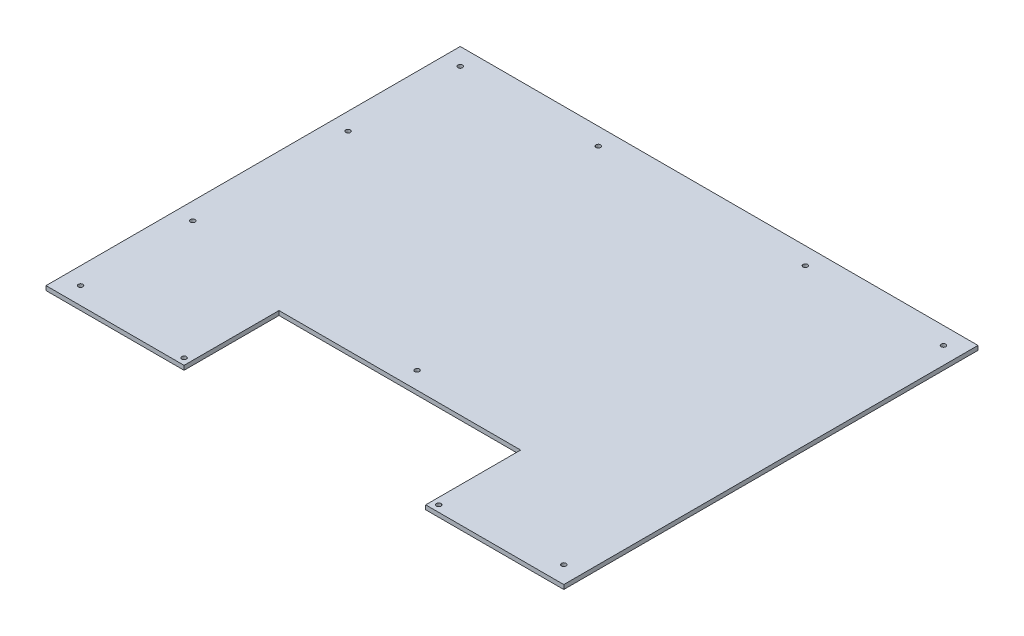
from build123d import *

# Parameters (mm, degrees)
BOSS_EXTRUDE1_DEPTH  = 3.175
M3_CLEARANCE_HOLE1_D = 3.4


with BuildPart() as part:
    # Sketch1 → Boss-Extrude1 (new body)
    with BuildSketch(Plane(origin=(0, 0, 0), x_dir=(1, 0, 0), z_dir=(0, 1, 0))):
        Polygon((-190.5, -152.4), (-88.9, -152.4), (-88.9, -82.55), (88.9, -82.55), (88.9, -152.4), (190.5, -152.4), (190.5, 152.4), (-190.5, 152.4), align=None)
    extrude(amount=BOSS_EXTRUDE1_DEPTH)

    # M3 Clearance Hole1 (through all)
    with Locations(Plane(origin=(-76.2, 3.175, -139.7), x_dir=(0, 0, 1), z_dir=(0, 1, 0))):
        with Locations((0, 0), (0, 152.4), (209.55, 76.2), (287.3248, -17.4752), (279.4, -101.6), (0, -101.6), (0, 254), (279.4, 254), (287.3248, 169.8752), (82.55, -101.6), (196.85, -101.6)):
            Hole(M3_CLEARANCE_HOLE1_D / 2)


solid = part.part
